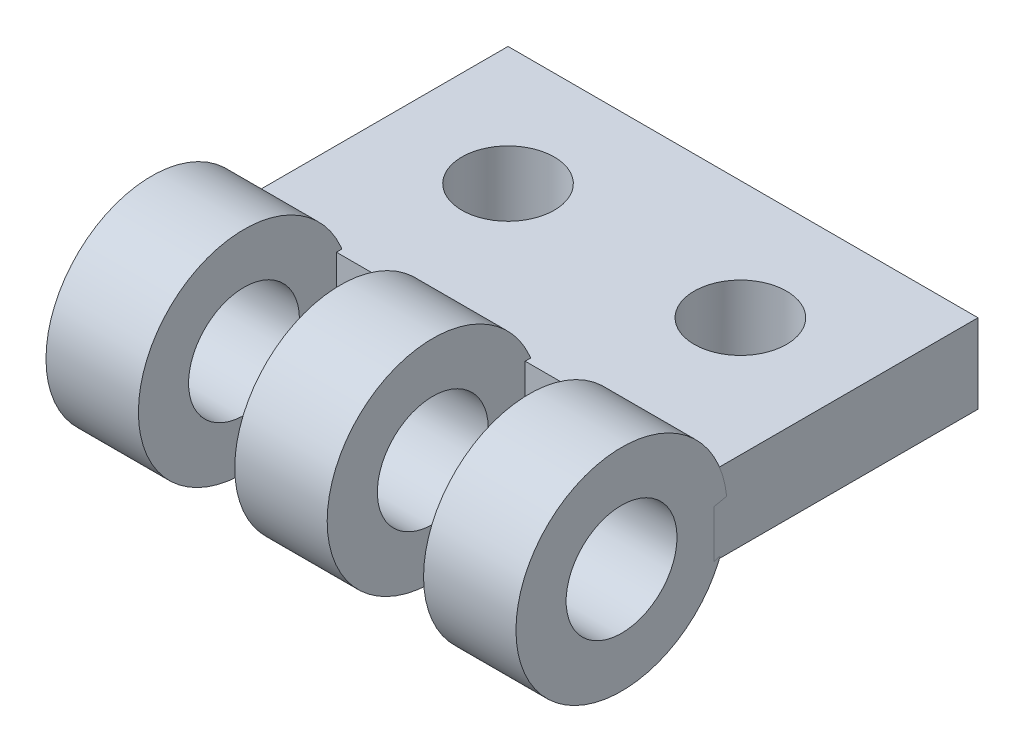
from build123d import *

# Parameters (mm, degrees)
CROQUIS1_R              = 4
CROQUIS1_R_2            = 2.1
SALIENTE_EXTRUIR1_DEPTH = 3.5
MATRIZL3_COUNT          = 3
MATRIZL3_PITCH          = 7.15
CROQUIS4_W              = 17.8
CROQUIS4_H              = 3
SALIENTE_EXTRUIR2_DEPTH = 10
CROQUIS5_R              = 1.75
CORTAR_EXTRUIR1_DEPTH   = 21.420333004


with BuildPart() as part:
    # Croquis1 → Saliente-Extruir1 (new body)
    with BuildSketch(Plane(origin=(0, 0, 0), x_dir=(0, -1, 0), z_dir=(1, 0, 0))):
        Circle(CROQUIS1_R)
        Circle(CROQUIS1_R_2, mode=Mode.SUBTRACT)
    extrude(amount=SALIENTE_EXTRUIR1_DEPTH)


with BuildPart() as matrizl3_1:
    # MatrizL3: pattern copy
    add(part.part.moved(Location(Vector(-1, 0, 0) * (1 * MATRIZL3_PITCH))))


with BuildPart() as matrizl3_2:
    # MatrizL3: pattern copy
    add(part.part.moved(Location(Vector(-1, 0, 0) * (2 * MATRIZL3_PITCH))))


with BuildPart() as body_4:
    # Croquis4 → Saliente-Extruir2 (new body)
    with BuildSketch(Plane.XY.offset(-3.5)):
        with Locations((-5.4, 0)):
            Rectangle(CROQUIS4_W, CROQUIS4_H)
    extrude(amount=-SALIENTE_EXTRUIR2_DEPTH)

    # Croquis5 → Cortar-Extruir1 (cut, through all)
    with BuildSketch(Plane(origin=(0, 1.5, 0), x_dir=(1, 0, 0), z_dir=(0, 1, 0))):
        with Locations((-1, 9)):
            Circle(CROQUIS5_R)
        with Locations((-9.8, 9)):
            Circle(CROQUIS5_R)
    extrude(amount=-CORTAR_EXTRUIR1_DEPTH, mode=Mode.SUBTRACT)


solid = Compound([part.part, matrizl3_1.part, matrizl3_2.part, body_4.part])
